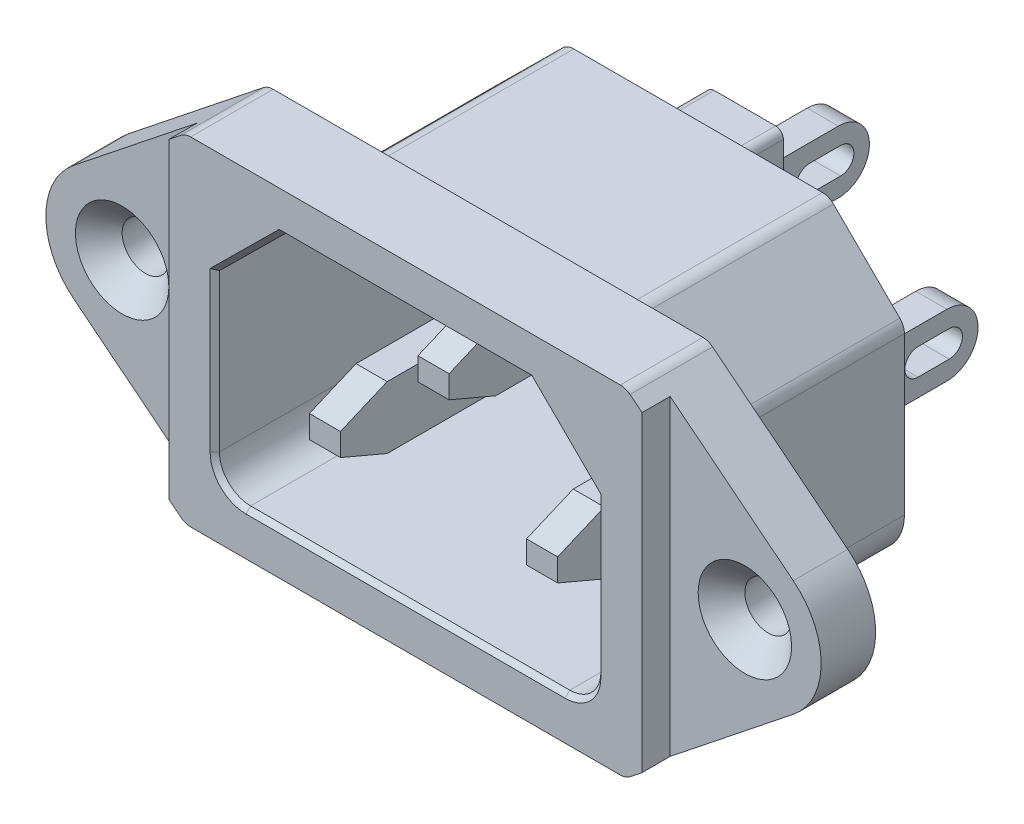
from build123d import *
from OCP.BRepFilletAPI import BRepFilletAPI_MakeChamfer

# Parameters (mm, degrees)
SKETCH1_R               = 1.5
BOSS_EXTRUDE1_DEPTH     = 21.8
CUT_EXTRUDE1_START      = -1.8
SKETCH2_W               = 54.830632019
SKETCH2_H               = 32.18582254
CUT_EXTRUDE1_DEPTH      = 1.8
SKETCH3_W               = 57.724078453
SKETCH3_H               = 32.716020725
CUT_EXTRUDE2_DEPTH      = 16.5
FILLET1_R               = 3
FILLET2_R               = 1
CUT_EXTRUDE3_DEPTH      = 17.8
CHAMFER1_SIZE           = 0.3
CHAMFER2_SIZE           = 1.5
SKETCH5_W               = 33.078515986
SKETCH5_H               = 22.592086676
CUT_EXTRUDE4_DEPTH      = 3
SKETCH6_W               = 2
SKETCH6_H               = 4
BOSS_EXTRUDE2_DEPTH     = 27
CHAMFER3_SIZE           = 3
CHAMFER3_SIZE2          = 1.273424449
CUT_EXTRUDE5_DEPTH      = 36.549578057
CUT_EXTRUDE5_DEPTH_BACK = 36.549578057
FILLET3_R               = 2


with BuildPart() as part:
    # Sketch1 → Boss-Extrude1 (new body)
    with BuildSketch(Plane.XY):
        with BuildLine():
            Line((1.791039749, 3.715784471), (10.476580913, 10.632270415))
            ThreePointArc((10.476580913, 10.632270415), (10.769573262, 10.79399958), (11.099519913, 10.85))
            Line((11.099519913, 10.85), (38.700480087, 10.85))
            ThreePointArc((38.700480087, 10.85), (39.030426738, 10.79399958), (39.323419087, 10.632270415))
            Line((39.323419087, 10.632270415), (48.008960251, 3.715784471))
            ThreePointArc((48.008960251, 3.715784471), (49.8, 0), (48.008960251, -3.715784471))
            Line((48.008960251, -3.715784471), (39.323419087, -10.632270415))
            ThreePointArc((39.323419087, -10.632270415), (39.030426738, -10.79399958), (38.700480087, -10.85))
            Line((38.700480087, -10.85), (11.099519913, -10.85))
            ThreePointArc((11.099519913, -10.85), (10.769573262, -10.79399958), (10.476580913, -10.632270415))
            Line((10.476580913, -10.632270415), (1.791039749, -3.715784471))
            ThreePointArc((1.791039749, -3.715784471), (0, 0), (1.791039749, 3.715784471))
        make_face()
        with Locations((4.9, 0)):
            Circle(SKETCH1_R, mode=Mode.SUBTRACT)
        with Locations((44.9, 0)):
            Circle(SKETCH1_R, mode=Mode.SUBTRACT)
    extrude(amount=BOSS_EXTRUDE1_DEPTH)

    # Sketch2 → Cut-Extrude1 (cut)
    with BuildSketch(Plane.XY.offset(21.8).offset(CUT_EXTRUDE1_START)):
        with Locations((23.298408534, -3.305326345)):
            Rectangle(SKETCH2_W, SKETCH2_H)
        with BuildLine():
            Line((11.099519913, -10.85), (38.700480087, -10.85))
            ThreePointArc((38.700480087, -10.85), (39.030426738, -10.79399958), (39.323419087, -10.632270415))
            Line((39.323419087, -10.632270415), (40.1, -10.013862089))
            Line((40.1, -10.013862089), (40.1, 10.013862089))
            Line((40.1, 10.013862089), (39.323419087, 10.632270415))
            ThreePointArc((39.323419087, 10.632270415), (39.030426738, 10.79399958), (38.700480087, 10.85))
            Line((38.700480087, 10.85), (11.099519913, 10.85))
            ThreePointArc((11.099519913, 10.85), (10.769573262, 10.79399958), (10.476580913, 10.632270415))
            Line((10.476580913, 10.632270415), (9.7, 10.013862089))
            Line((9.7, 10.013862089), (9.7, -10.013862089))
            Line((9.7, -10.013862089), (10.476580913, -10.632270415))
            ThreePointArc((10.476580913, -10.632270415), (10.769573262, -10.79399958), (11.099519913, -10.85))
        make_face(mode=Mode.SUBTRACT)
    extrude(amount=CUT_EXTRUDE1_DEPTH, mode=Mode.SUBTRACT)

    # Sketch3 → Cut-Extrude2 (cut)
    with BuildSketch(Plane(origin=(0, 0, 0), x_dir=(-1, 0, 0), z_dir=(0, 0, -1))):
        with Locations((-24.814355967, -1.741428677)):
            Rectangle(SKETCH3_W, SKETCH3_H)
        Polygon((-38.15, -9.05), (-38.15, 4.45), (-33.3, 9.25), (-16.5, 9.25), (-11.65, 4.45), (-11.65, -9.05), align=None, mode=Mode.SUBTRACT)
    extrude(amount=-CUT_EXTRUDE2_DEPTH, mode=Mode.SUBTRACT)

    # Fillet1
    fillet1_edges = [part.edges().sort_by_distance(p)[0] for p in [
        (38.15, -9.05, 8.25),
        (11.65, -9.05, 8.25),
    ]]
    fillet(fillet1_edges, radius=FILLET1_R)

    # Fillet2
    fillet2_edges = [part.edges().sort_by_distance(p)[0] for p in [
        (38.15, 4.45, 8.25),
        (33.3, 9.25, 8.25),
        (16.5, 9.25, 8.25),
        (11.65, 4.45, 8.25),
    ]]
    fillet(fillet2_edges, radius=FILLET2_R)

    # Sketch4 → Cut-Extrude3 (cut)
    with BuildSketch(Plane.XY.offset(21.8)):
        with BuildLine():
            Line((37.15, 4.032748035), (32.888818327, 8.25))
            Line((32.888818327, 8.25), (16.911181673, 8.25))
            Line((16.911181673, 8.25), (12.65, 4.032748035))
            Line((12.65, 4.032748035), (12.65, -6.05))
            ThreePointArc((12.65, -6.05), (13.235786438, -7.464213562), (14.65, -8.05))
            Line((14.65, -8.05), (35.15, -8.05))
            ThreePointArc((35.15, -8.05), (36.564213562, -7.464213562), (37.15, -6.05))
            Line((37.15, -6.05), (37.15, 4.032748035))
        make_face()
    extrude(amount=-CUT_EXTRUDE3_DEPTH, mode=Mode.SUBTRACT)

    # Chamfer1
    chamfer1_edges = [part.edges().sort_by_distance(p)[0] for p in [
        (37.15, -1.008625983, 21.8),
        (35.019409163, 6.141374017, 21.8),
        (24.9, 8.25, 21.8),
        (14.780590837, 6.141374017, 21.8),
        (12.65, -1.008625983, 21.8),
        (13.235786438, -7.464213562, 21.8),
        (24.9, -8.05, 21.8),
        (36.564213562, -7.464213562, 21.8),
    ]]
    chamfer(chamfer1_edges, length=CHAMFER1_SIZE)

    # Chamfer2
    chamfer2_edges = [part.edges().sort_by_distance(p)[0] for p in [
        (3.4, 0, 20),
        (43.4, 0, 20),
    ]]
    chamfer(chamfer2_edges, length=CHAMFER2_SIZE)

    # Sketch5 → Cut-Extrude4 (cut)
    with BuildSketch(Plane(origin=(0, 0, 0), x_dir=(-1, 0, 0), z_dir=(0, 0, -1))):
        with Locations((-24.236330555, -0.057007702)):
            Rectangle(SKETCH5_W, SKETCH5_H)
        with BuildLine():
            Line((-26.875, -1.55), (-22.925, -1.55))
            ThreePointArc((-22.925, -1.55), (-22.571446609, -1.403553391), (-22.425, -1.05))
            Line((-22.425, -1.05), (-22.425, 7.95))
            ThreePointArc((-22.425, 7.95), (-22.571446609, 8.303553391), (-22.925, 8.45))
            Line((-22.925, 8.45), (-26.875, 8.45))
            ThreePointArc((-26.875, 8.45), (-27.228553391, 8.303553391), (-27.375, 7.95))
            Line((-27.375, 7.95), (-27.375, -1.05))
            ThreePointArc((-27.375, -1.05), (-27.228553391, -1.403553391), (-26.875, -1.55))
        make_face(mode=Mode.SUBTRACT)
        with BuildLine():
            Line((-19.9, -8.25), (-15.95, -8.25))
            ThreePointArc((-15.95, -8.25), (-15.596446609, -8.103553391), (-15.45, -7.75))
            Line((-15.45, -7.75), (-15.45, 1.25))
            ThreePointArc((-15.45, 1.25), (-15.596446609, 1.603553391), (-15.95, 1.75))
            Line((-15.95, 1.75), (-19.9, 1.75))
            ThreePointArc((-19.9, 1.75), (-20.253553391, 1.603553391), (-20.4, 1.25))
            Line((-20.4, 1.25), (-20.4, -7.75))
            ThreePointArc((-20.4, -7.75), (-20.253553391, -8.103553391), (-19.9, -8.25))
        make_face(mode=Mode.SUBTRACT)
        with BuildLine():
            Line((-33.85, -8.25), (-29.9, -8.25))
            ThreePointArc((-29.9, -8.25), (-29.546446609, -8.103553391), (-29.4, -7.75))
            Line((-29.4, -7.75), (-29.4, 1.25))
            ThreePointArc((-29.4, 1.25), (-29.546446609, 1.603553391), (-29.9, 1.75))
            Line((-29.9, 1.75), (-33.85, 1.75))
            ThreePointArc((-33.85, 1.75), (-34.203553391, 1.603553391), (-34.35, 1.25))
            Line((-34.35, 1.25), (-34.35, -7.75))
            ThreePointArc((-34.35, -7.75), (-34.203553391, -8.103553391), (-33.85, -8.25))
        make_face(mode=Mode.SUBTRACT)
    extrude(amount=-CUT_EXTRUDE4_DEPTH, mode=Mode.SUBTRACT)

    # Sketch6 → Boss-Extrude2 (add)
    with BuildSketch(Plane.XY.offset(20)):
        with Locations((24.9, 3.45)):
            Rectangle(SKETCH6_W, SKETCH6_H)
        with Locations((17.925, -3.25)):
            Rectangle(SKETCH6_W, SKETCH6_H)
        with Locations((31.875, -3.25)):
            Rectangle(SKETCH6_W, SKETCH6_H)
    extrude(amount=-BOSS_EXTRUDE2_DEPTH)

    # Chamfer3: one chamfer whose edges measure the first distance from different faces: ONE call of the kernel's chamfer builder (chamfer() names one face for all edges)
    chamfer3_edges_1 = [part.edges().sort_by_distance(p)[0] for p in [
        (24.9, 1.45, 20),
    ]]
    chamfer3_side_1 = [part.faces().sort_by_distance(p)[0] for p in [
        (24.9, 1.45, 12),
    ]]
    chamfer3_edges_2 = [part.edges().sort_by_distance(p)[0] for p in [
        (24.9, 5.45, 20),
    ]]
    chamfer3_side_2 = [part.faces().sort_by_distance(p)[0] for p in [
        (24.9, 5.45, 12),
    ]]
    chamfer3_edges_3 = [part.edges().sort_by_distance(p)[0] for p in [
        (17.925, -5.25, 20),
    ]]
    chamfer3_side_3 = [part.faces().sort_by_distance(p)[0] for p in [
        (17.925, -5.25, 12),
    ]]
    chamfer3_edges_4 = [part.edges().sort_by_distance(p)[0] for p in [
        (17.925, -1.25, 20),
    ]]
    chamfer3_side_4 = [part.faces().sort_by_distance(p)[0] for p in [
        (17.925, -1.25, 12),
    ]]
    chamfer3_edges_5 = [part.edges().sort_by_distance(p)[0] for p in [
        (31.875, -5.25, 20),
    ]]
    chamfer3_side_5 = [part.faces().sort_by_distance(p)[0] for p in [
        (31.875, -5.25, 12),
    ]]
    chamfer3_edges_6 = [part.edges().sort_by_distance(p)[0] for p in [
        (31.875, -1.25, 20),
    ]]
    chamfer3_side_6 = [part.faces().sort_by_distance(p)[0] for p in [
        (31.875, -1.25, 12),
    ]]
    chamfer3 = BRepFilletAPI_MakeChamfer(part.part.solid().wrapped)
    for e in chamfer3_edges_1:
        chamfer3.Add(CHAMFER3_SIZE, CHAMFER3_SIZE2, e.wrapped, chamfer3_side_1[0].wrapped)  # the first distance lies on this face
    for e in chamfer3_edges_2:
        chamfer3.Add(CHAMFER3_SIZE, CHAMFER3_SIZE2, e.wrapped, chamfer3_side_2[0].wrapped)  # the first distance lies on this face
    for e in chamfer3_edges_3:
        chamfer3.Add(CHAMFER3_SIZE, CHAMFER3_SIZE2, e.wrapped, chamfer3_side_3[0].wrapped)  # the first distance lies on this face
    for e in chamfer3_edges_4:
        chamfer3.Add(CHAMFER3_SIZE, CHAMFER3_SIZE2, e.wrapped, chamfer3_side_4[0].wrapped)  # the first distance lies on this face
    for e in chamfer3_edges_5:
        chamfer3.Add(CHAMFER3_SIZE, CHAMFER3_SIZE2, e.wrapped, chamfer3_side_5[0].wrapped)  # the first distance lies on this face
    for e in chamfer3_edges_6:
        chamfer3.Add(CHAMFER3_SIZE, CHAMFER3_SIZE2, e.wrapped, chamfer3_side_6[0].wrapped)  # the first distance lies on this face
    add(Compound.cast(chamfer3.Shape()), mode=Mode.REPLACE)

    # Sketch7 → Cut-Extrude5 (cut, two sides: drawn at the far end of the back side and taken through both)
    with BuildSketch(Plane(origin=(25.9, 0, 0), x_dir=(0, 0, -1), z_dir=(1, 0, 0)).offset(-CUT_EXTRUDE5_DEPTH_BACK)):
        with BuildLine():
            Line((3.15, 4.3), (5.15, 4.3))
            ThreePointArc((5.15, 4.3), (6, 3.45), (5.15, 2.6))
            Line((5.15, 2.6), (3.15, 2.6))
            ThreePointArc((3.15, 2.6), (2.3, 3.45), (3.15, 4.3))
        make_face()
        with BuildLine():
            Line((3.15, -2.4), (5.15, -2.4))
            ThreePointArc((5.15, -2.4), (6, -3.25), (5.15, -4.1))
            Line((5.15, -4.1), (3.15, -4.1))
            ThreePointArc((3.15, -4.1), (2.3, -3.25), (3.15, -2.4))
        make_face()
    extrude(amount=CUT_EXTRUDE5_DEPTH + CUT_EXTRUDE5_DEPTH_BACK, mode=Mode.SUBTRACT)

    # Fillet3
    fillet3_edges = [part.edges().sort_by_distance(p)[0] for p in [
        (31.875, -5.25, -7),
        (31.875, -1.25, -7),
        (17.925, -5.25, -7),
        (24.9, 1.45, -7),
        (17.925, -1.25, -7),
        (24.9, 5.45, -7),
    ]]
    fillet(fillet3_edges, radius=FILLET3_R - 0.0001)  # a hair under: the kernel refuses the full size


solid = part.part
